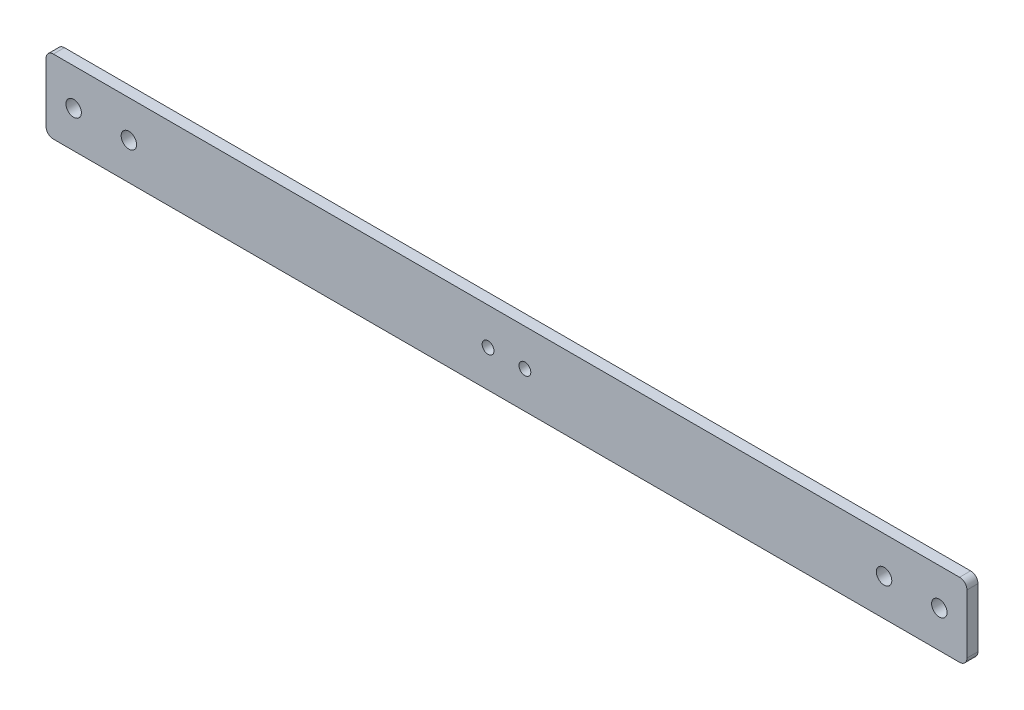
from build123d import *

# Parameters (mm, degrees)
SKETCH_1_W          = 250
SKETCH_1_H          = 20
EXTRUDE_1_DEPTH     = 3
SKETCH_2_R          = 2.1
SKETCH_2_R_2        = 1.6
CUT_EXTRUDE_1_DEPTH = 3
FILLET_1_R          = 2


with BuildPart() as part:
    # 草图1 → 凸台-拉伸1 (new body)
    with BuildSketch(Plane.XY):
        Rectangle(SKETCH_1_W, SKETCH_1_H)
    extrude(amount=EXTRUDE_1_DEPTH)

    # 草图2 → 切除-拉伸1 (cut)
    with BuildSketch(Plane.XY.offset(3)):
        with Locations((-117.5, 0)):
            Circle(SKETCH_2_R)
        with Locations((-102.5, 0)):
            Circle(SKETCH_2_R)
        with Locations((102.5, 0)):
            Circle(SKETCH_2_R)
        with Locations((117.5, 0)):
            Circle(SKETCH_2_R)
        with Locations((-5, 0)):
            Circle(SKETCH_2_R_2)
        with Locations((5, 0)):
            Circle(SKETCH_2_R_2)
    extrude(amount=-CUT_EXTRUDE_1_DEPTH, mode=Mode.SUBTRACT)

    # 圆角1
    fillet_1_edges = [part.edges().sort_by_distance(p)[0] for p in [
        (125, -10, 1.5),
        (125, 10, 1.5),
        (-125, -10, 1.5),
        (-125, 10, 1.5),
    ]]
    fillet(fillet_1_edges, radius=FILLET_1_R)


solid = part.part
